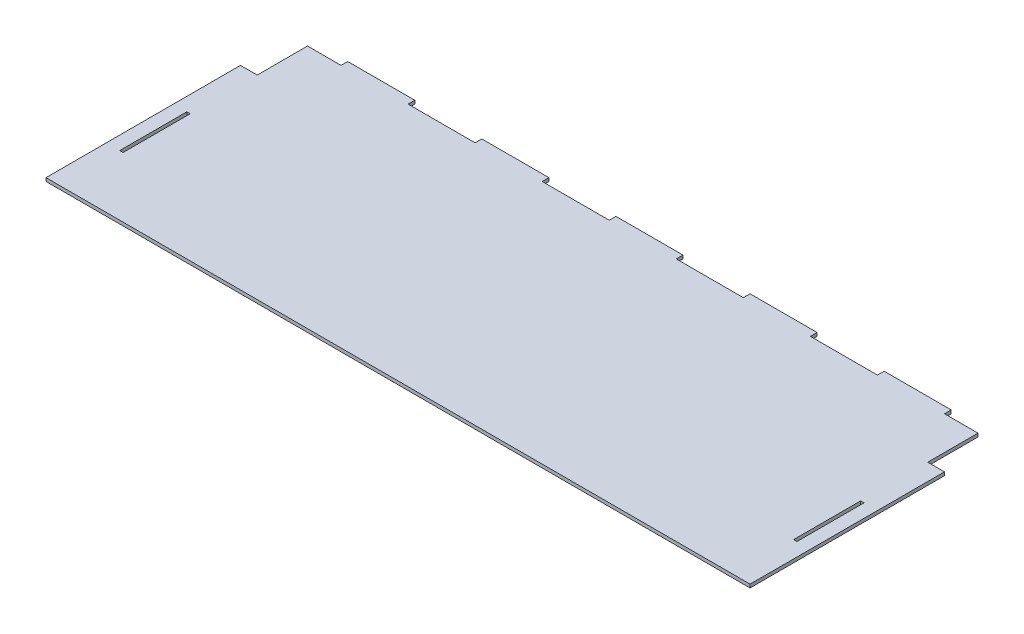
from build123d import *

# Parameters (mm, degrees)
SKICA1_W                = 1
SKICA1_H                = 20
P_IDAT_VYSUNUT_M1_DEPTH = 1


with BuildPart() as part:
    # Skica1 → Přidat vysunutím1 (new body)
    with BuildSketch(Plane(origin=(0, 0, 0), x_dir=(1, 0, 0), z_dir=(0, 1, 0))):
        Polygon((0, 73), (0, 58), (-5, 58), (-5, 0), (100, 0), (205, 0), (205, 58), (200, 58), (200, 73), (190, 73), (190, 75), (170, 75), (170, 73), (150, 73), (150, 75), (130, 75), (130, 73), (110, 73), (110, 75), (90, 75), (90, 73), (70, 73), (70, 75), (50, 75), (50, 73), (30, 73), (30, 75), (10, 75), (10, 73), align=None)
        with Locations((-0.5, 28)):
            Rectangle(SKICA1_W, SKICA1_H, mode=Mode.SUBTRACT)
        with Locations((200.5, 28)):
            Rectangle(SKICA1_W, SKICA1_H, mode=Mode.SUBTRACT)
    extrude(amount=P_IDAT_VYSUNUT_M1_DEPTH)


solid = part.part
